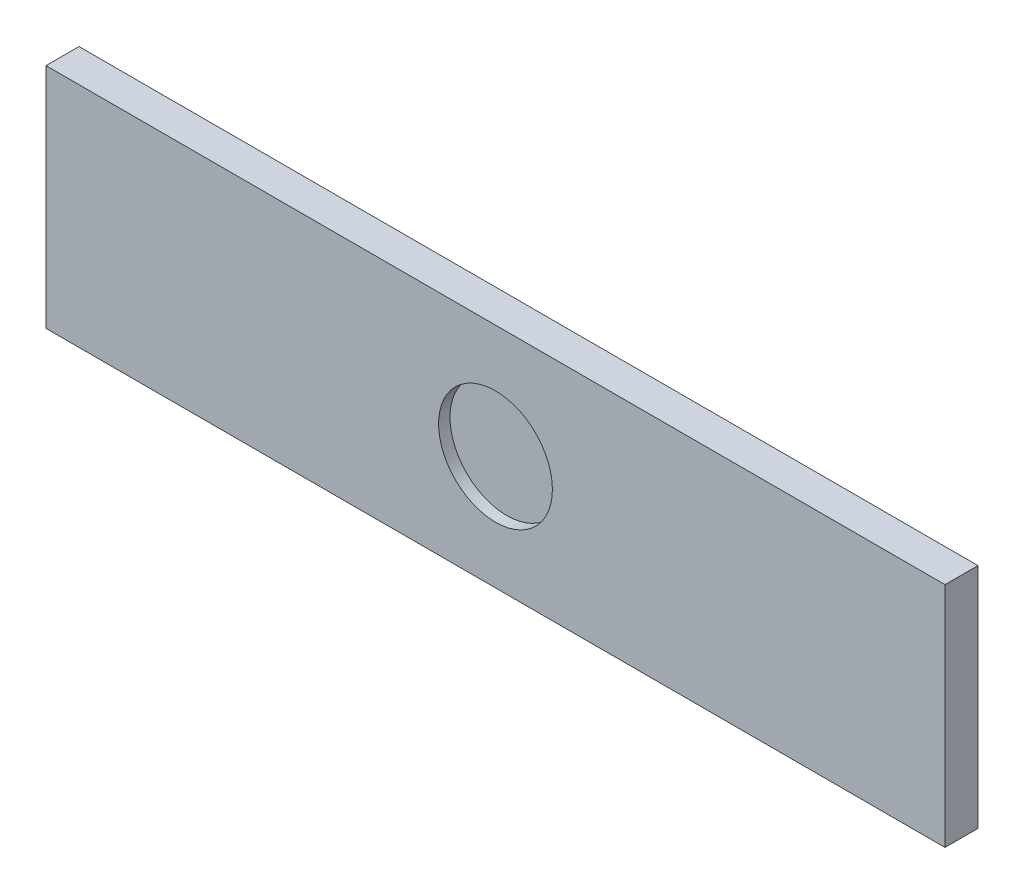
from build123d import *

# Parameters (mm, degrees)
SKETCH1_W           = 79
SKETCH1_H           = 20
BOSS_EXTRUDE1_DEPTH = 2.9
SKETCH2_R           = 5
CUT_EXTRUDE1_DEPTH  = 1


with BuildPart() as part:
    # Sketch1 → Boss-Extrude1 (new body)
    with BuildSketch(Plane.XY):
        Rectangle(SKETCH1_W, SKETCH1_H)
    extrude(amount=BOSS_EXTRUDE1_DEPTH)

    # Sketch2 → Cut-Extrude1 (cut)
    with BuildSketch(Plane.XY.offset(2.9)):
        Circle(SKETCH2_R)
    extrude(amount=-CUT_EXTRUDE1_DEPTH, mode=Mode.SUBTRACT)


solid = part.part
